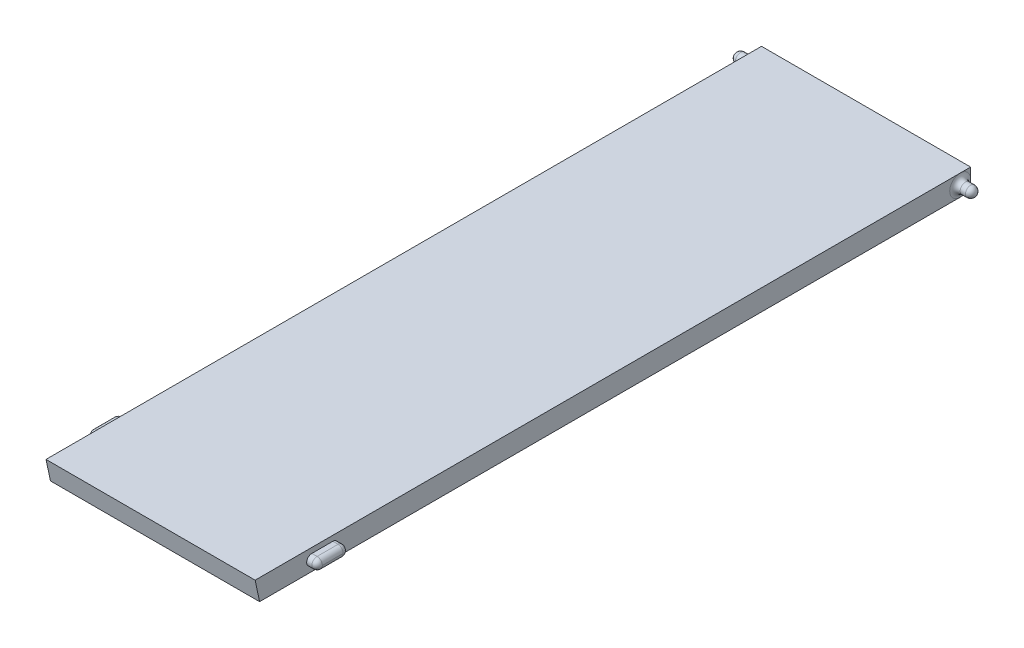
from build123d import *

# Parameters (mm, degrees)
SKETCH1_W                       = 20
SKETCH1_H                       = 68
BOSS_EXTRUDE1_DEPTH             = 2
BOSS_EXTRUDE2_START             = 10
SKETCH2_R                       = 0.5
BOSS_EXTRUDE2_DEPTH             = 1.5
FILLET1_R                       = 0.5
FILLET4_R                       = 0.5
FILLET1_OF_MIRROR2_R            = 0.5
FILLET4_OF_MIRROR2_R            = 0.5
FILLET2_R                       = 1
BOSS_EXTRUDE3_REACH             = 37.948
BOSS_EXTRUDE3_DIRECTION_2_REACH = 37.948
BOSS_EXTRUDE4_START             = 10
BOSS_EXTRUDE4_DEPTH             = 1
FILLET3_R                       = 0.5
FILLET3_OF_MIRROR4_R            = 0.5


with BuildPart() as part:
    # Sketch1 → Boss-Extrude1 (new body)
    with BuildSketch(Plane(origin=(0, 0, 0), x_dir=(1, 0, 0), z_dir=(0, 1, 0))):
        Rectangle(SKETCH1_W, SKETCH1_H)
    extrude(amount=BOSS_EXTRUDE1_DEPTH)

    # Sketch2 → Boss-Extrude2 (add)
    with BuildSketch(Plane(origin=(0, 0, 0), x_dir=(0, 0, -1), z_dir=(1, 0, 0)).offset(BOSS_EXTRUDE2_START)):
        with Locations(Location((33, 1, 0), (0, 0, 180))):
            Circle(SKETCH2_R)
    boss_extrude2 = extrude(amount=BOSS_EXTRUDE2_DEPTH)

    # Fillet1
    fillet1_edges = [part.edges().sort_by_distance(p)[0] for p in [
        (11.5, 1, -33.5),
    ]]
    fillet(fillet1_edges, radius=FILLET1_R)

    # Fillet4
    fillet4_edges = [part.edges().sort_by_distance(p)[0] for p in [
        (10, 1, -33.5),
    ]]
    fillet(fillet4_edges, radius=FILLET4_R - 0.0001)  # a hair under: the kernel refuses the full size

    # Mirror2: Boss-Extrude2 across plane
    add(boss_extrude2.mirror(Plane(origin=(0, 0, 0), x_dir=(0, 0, 1), z_dir=(1, 0, 0))))

    # Fillet1 of Mirror2
    fillet1_of_mirror2_edges = [part.edges().sort_by_distance(p)[0] for p in [
        (-11.5, 1, -33.5),
    ]]
    fillet(fillet1_of_mirror2_edges, radius=FILLET1_OF_MIRROR2_R)

    # Fillet4 of Mirror2
    fillet4_of_mirror2_edges = [part.edges().sort_by_distance(p)[0] for p in [
        (-10, 1, -33.5),
    ]]
    fillet(fillet4_of_mirror2_edges, radius=FILLET4_OF_MIRROR2_R - 0.0001)  # a hair under: the kernel refuses the full size

    # Fillet2
    fillet2_edges = [part.edges().sort_by_distance(p)[0] for p in [
        (0, 0, -34),
    ]]
    fillet(fillet2_edges, radius=FILLET2_R)

    # Boss-Extrude3: up to this face of the body (flat: up to its plane)
    boss_extrude3_end = Plane(part.part.faces().sort_by_distance((10, 1.001256492, 0.836072409))[0])
    # Sketch3 → Boss-Extrude3 (add, up to the picked face)
    with BuildSketch(Plane(origin=(0, 0, 0), x_dir=(0, 0, -1), z_dir=(1, 0, 0)), mode=Mode.PRIVATE) as boss_extrude3_sk1:
        Polygon((-34, 2), (-34.428032686, 2), (-34, 0), align=None)
    boss_extrude3_tool1 = split(extrude(boss_extrude3_sk1.sketch, amount=BOSS_EXTRUDE3_REACH, mode=Mode.PRIVATE), bisect_by=boss_extrude3_end, keep=Keep.BOTH, mode=Mode.PRIVATE)
    add(boss_extrude3_tool1.solids().sort_by(Axis((0, 1.333333, 34.142678), (1, 0, 0)))[0])

    # Boss-Extrude3 direction 2: up to this face of the body (flat: up to its plane)
    boss_extrude3_direction_2_end = Plane(part.part.faces().sort_by_distance((-10, 1.001256492, 0.836072409))[0])
    # Sketch3 → Boss-Extrude3 direction 2 (add, up to the picked face)
    with BuildSketch(Plane(origin=(0, 0, 0), x_dir=(0, 0, -1), z_dir=(1, 0, 0)), mode=Mode.PRIVATE) as boss_extrude3_direction_2_sk1:
        Polygon((-34, 2), (-34.428032686, 2), (-34, 0), align=None)
    boss_extrude3_direction_2_tool1 = split(extrude(boss_extrude3_direction_2_sk1.sketch, amount=-BOSS_EXTRUDE3_DIRECTION_2_REACH, mode=Mode.PRIVATE), bisect_by=boss_extrude3_direction_2_end, keep=Keep.BOTH, mode=Mode.PRIVATE)
    add(boss_extrude3_direction_2_tool1.solids().sort_by(Axis((0, 1.333333, 34.142678), (-1, 0, 0)))[0])

    # Sketch4 → Boss-Extrude4 (add)
    with BuildSketch(Plane(origin=(0, 0, 0), x_dir=(0, 0, -1), z_dir=(1, 0, 0)).offset(BOSS_EXTRUDE4_START)):
        with BuildLine():
            Line((-27, 0.5), (-29, 0.5))
            ThreePointArc((-29, 0.5), (-29.5, 1), (-29, 1.5))
            Line((-29, 1.5), (-27, 1.5))
            ThreePointArc((-27, 1.5), (-26.5, 1), (-27, 0.5))
        make_face()
    boss_extrude4 = extrude(amount=BOSS_EXTRUDE4_DEPTH)

    # Fillet3
    fillet3_edges = [part.edges().sort_by_distance(p)[0] for p in [
        (11, 1, 29.5),
        (11, 1, 26.5),
        (11, 0.5, 28),
        (11, 1.5, 28),
    ]]
    fillet(fillet3_edges, radius=FILLET3_R)

    # Mirror4: Boss-Extrude4 across plane
    add(boss_extrude4.mirror(Plane(origin=(0, 0, 0), x_dir=(0, 0, 1), z_dir=(1, 0, 0))))

    # Fillet3 of Mirror4
    fillet3_of_mirror4_edges = [part.edges().sort_by_distance(p)[0] for p in [
        (-11, 1, 29.5),
        (-11, 1, 26.5),
        (-11, 0.5, 28),
        (-11, 1.5, 28),
    ]]
    fillet(fillet3_of_mirror4_edges, radius=FILLET3_OF_MIRROR4_R)


solid = part.part
